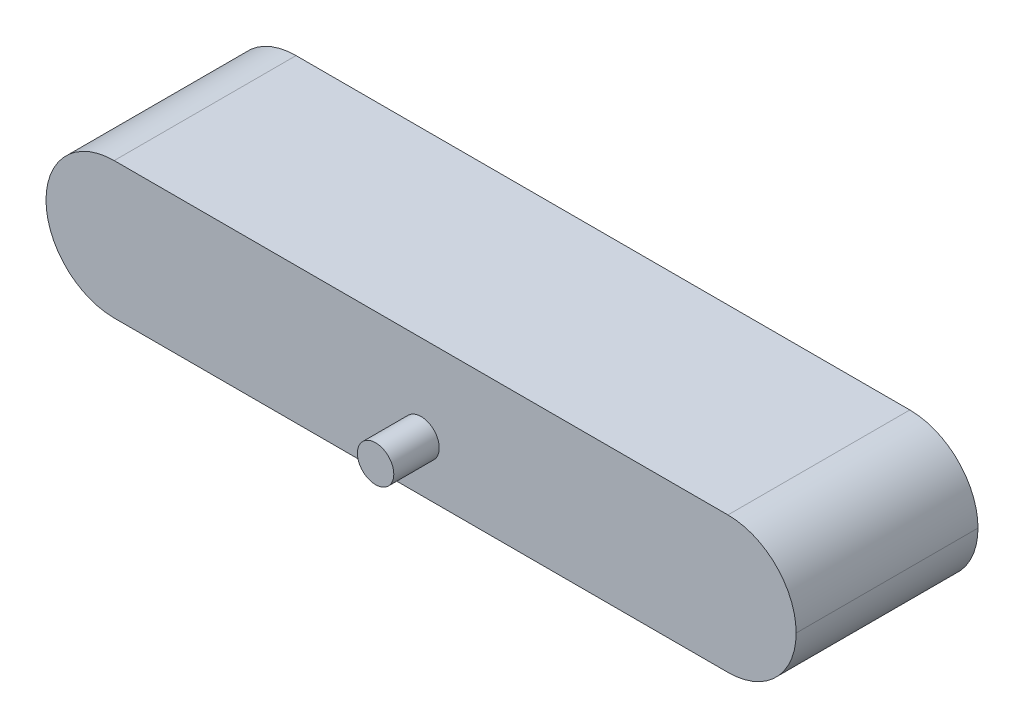
from build123d import *

# Parameters (mm, degrees)
SKETCH1_W           = 165
SKETCH1_H           = 30
BOSS_EXTRUDE1_DEPTH = 40
FILLET1_R           = 15
SKETCH2_W           = 26
SKETCH2_H           = 7
BOSS_EXTRUDE2_DEPTH = 6
SKETCH3_R           = 4
BOSS_EXTRUDE3_DEPTH = 10


with BuildPart() as part:
    # Sketch1 → Boss-Extrude1 (new body)
    with BuildSketch(Plane.XY):
        Rectangle(SKETCH1_W, SKETCH1_H)
    extrude(amount=BOSS_EXTRUDE1_DEPTH)

    # Fillet1
    fillet1_edges = [part.edges().sort_by_distance(p)[0] for p in [
        (-82.5, 15, 20),
        (82.5, -15, 20),
        (-82.5, -15, 20),
        (82.5, 15, 20),
    ]]
    fillet(fillet1_edges, radius=FILLET1_R - 0.0001)  # a hair under: the kernel refuses the full size

    # Sketch2 → Boss-Extrude2 (add)
    with BuildSketch(Plane.XZ.offset(15)):
        with Locations((0, 10.5)):
            Rectangle(SKETCH2_W, SKETCH2_H)
    extrude(amount=BOSS_EXTRUDE2_DEPTH)

    # Sketch3 → Boss-Extrude3 (add)
    with BuildSketch(Plane.XY.offset(40)):
        with Locations((0, -4)):
            Circle(SKETCH3_R)
    extrude(amount=BOSS_EXTRUDE3_DEPTH)


solid = part.part
